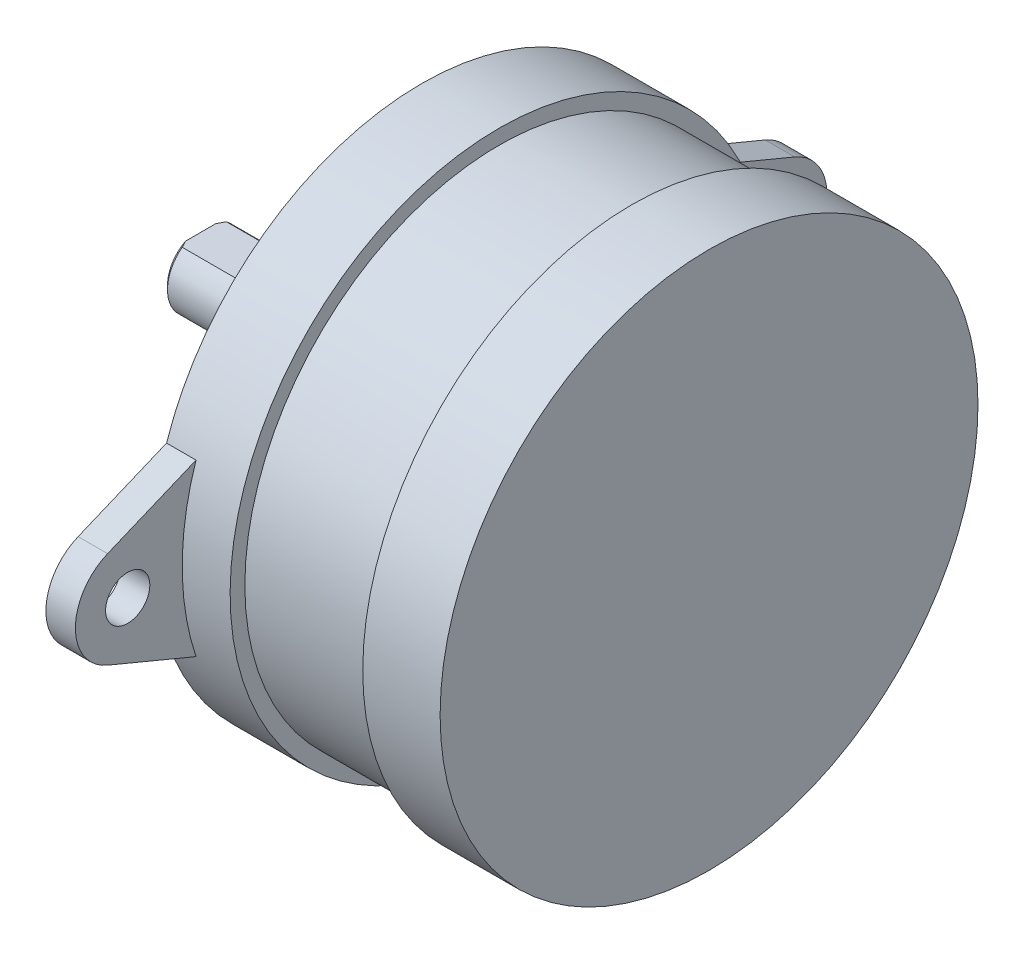
from build123d import *

# Parameters (mm, degrees)
ESQUISSE2_R             = 18.25
BOSS_EXTRU_1_DEPTH      = 5.25
ESQUISSE3_R             = 17.25
BOSS_EXTRU_2_DEPTH      = 9
ESQUISSE4_R             = 18.25
BOSS_EXTRU_3_DEPTH      = 5.25
ESQUISSE6_R             = 1.5
BOSS_EXTRU_4_DEPTH      = 2
ESQUISSE7_R             = 8
BOSS_EXTRU_5_DEPTH      = 2
ESQUISSE8_R             = 2.5
BOSS_EXTRU_6_DEPTH      = 15
CHANFREIN1_SIZE         = 0.25
ESQUISSE9_W             = 5
ESQUISSE9_H             = 1
ENL_V_MAT_EXTRU_1_DEPTH = 10


with BuildPart() as part:
    # Esquisse2 → Boss.-Extru.1 (new body)
    with BuildSketch(Plane(origin=(0, 0, 0), x_dir=(0, 0, -1), z_dir=(1, 0, 0))):
        Circle(ESQUISSE2_R)
    extrude(amount=BOSS_EXTRU_1_DEPTH)

    # Esquisse3 → Boss.-Extru.2 (add)
    with BuildSketch(Plane(origin=(5.25, 0, 0), x_dir=(0, 0, -1), z_dir=(1, 0, 0))):
        Circle(ESQUISSE3_R)
    extrude(amount=BOSS_EXTRU_2_DEPTH)

    # Esquisse4 → Boss.-Extru.3 (add)
    with BuildSketch(Plane(origin=(14.25, 0, 0), x_dir=(0, 0, -1), z_dir=(1, 0, 0))):
        Circle(ESQUISSE4_R)
    extrude(amount=BOSS_EXTRU_3_DEPTH)

    # Esquisse6 → Boss.-Extru.4 (add)
    # profile 1 of 2: a face of its own
    with BuildSketch(Plane.ZY):
        with BuildLine():
            ThreePointArc((23.313667029, -3.27763821), (25.5, 0), (23.313667029, 3.27763821))
            Line((23.313667029, 3.27763821), (17.312357631, 5.774493333))
            ThreePointArc((17.312357631, 5.774493333), (18.25, 0), (17.312357631, -5.774493333))
            Line((17.312357631, -5.774493333), (23.313667029, -3.27763821))
        make_face()
        with Locations((21.95, 0)):
            Circle(ESQUISSE6_R, mode=Mode.SUBTRACT)
    # profile 2 of 2: a face of its own
    with BuildSketch(Plane.ZY):
        with BuildLine():
            ThreePointArc((-17.312357631, -5.774493333), (-18.25, 0), (-17.312357631, 5.774493333))
            Line((-17.312357631, 5.774493333), (-23.313667029, 3.27763821))
            ThreePointArc((-23.313667029, 3.27763821), (-25.5, 0), (-23.313667029, -3.27763821))
            Line((-23.313667029, -3.27763821), (-17.312357631, -5.774493333))
        make_face()
        with Locations((-21.95, 0)):
            Circle(ESQUISSE6_R, mode=Mode.SUBTRACT)
    extrude(amount=-BOSS_EXTRU_4_DEPTH)

    # Esquisse7 → Boss.-Extru.5 (add)
    with BuildSketch(Plane.ZY):
        Circle(ESQUISSE7_R)
    extrude(amount=BOSS_EXTRU_5_DEPTH)

    # Esquisse8 → Boss.-Extru.6 (add)
    with BuildSketch(Plane.ZY):
        Circle(ESQUISSE8_R)
    extrude(amount=BOSS_EXTRU_6_DEPTH)

    # Chanfrein1
    chanfrein1_edges = [part.edges().sort_by_distance(p)[0] for p in [
        (-15, 0, -2.5),
    ]]
    chamfer(chanfrein1_edges, length=CHANFREIN1_SIZE)

    # Esquisse9 → Enlèv. mat.-Extru.1 (cut)
    with BuildSketch(Plane.ZY.offset(15)):
        with Locations((0, 2.5)):
            Rectangle(ESQUISSE9_W, ESQUISSE9_H)
    extrude(amount=-ENL_V_MAT_EXTRU_1_DEPTH, mode=Mode.SUBTRACT)


solid = part.part
